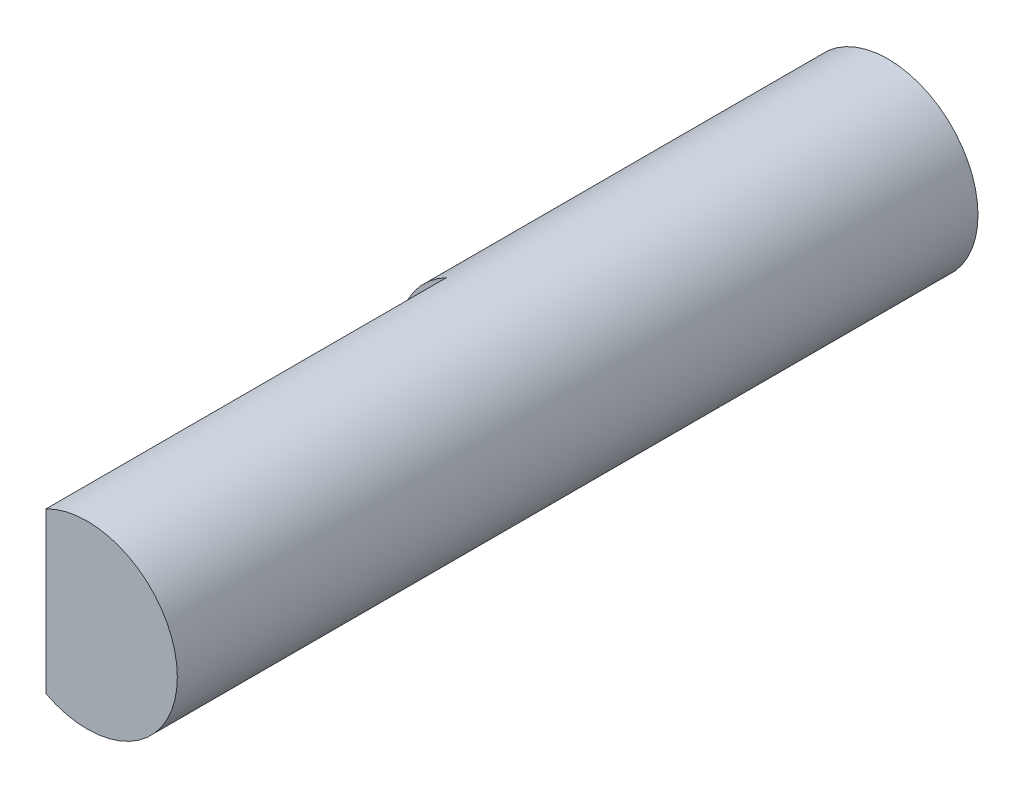
from build123d import *

# Parameters (mm, degrees)
EXTRUDE_4_DEPTH = 150
SKETCH_1_5_R    = 22.5
EXTRUDE_5_DEPTH = 100
EXTRUDE_6_DEPTH = 50
SHELL_START     = 1.5
SHELL_3_DEPTH   = 197
SHELL_3_2_DEPTH = 97


# Read off the part's stored shape, not the designer's step: 抽壳3
with BuildPart() as part:
    # 草图1 → 凸台-拉伸4 (new body)
    with BuildSketch(Plane.XY):
        with BuildLine():
            ThreePointArc((22.5, 0), (11.711646096, 19.211646096), (-10.307764064, 20))
            Line((-10.307764064, 20), (-10.307764064, -20))
            ThreePointArc((-10.307764064, -20), (11.711646096, -19.211646096), (22.5, 0))
        make_face()
    extrude(amount=EXTRUDE_4_DEPTH)

    # 草图1<5> → 凸台-拉伸5 (add)
    with BuildSketch(Plane.XY):
        with Locations(Location((0, 0, 0), (0, 0, 117.266044451))):
            Circle(SKETCH_1_5_R)
    extrude(amount=EXTRUDE_5_DEPTH)

    # 草图4 → 凸台-拉伸6 (add)
    with BuildSketch(Plane.XY.offset(150)):
        with BuildLine():
            ThreePointArc((-10.307764064, -20), (22.5, 0), (-10.307764064, 20))
            Line((-10.307764064, 20), (-10.307764064, -20))
        make_face()
    extrude(amount=EXTRUDE_6_DEPTH)

    # 抽壳3 outline → 抽壳3 (cut)
    with BuildSketch(Plane.XY.offset(SHELL_START)):
        with BuildLine():
            Line((-8.807764064, 19.063664186), (-8.807764064, -19.063664186))
            ThreePointArc((-8.807764064, -19.063664186), (21, 0), (-8.807764064, 19.063664186))
        make_face()
    extrude(amount=SHELL_3_DEPTH, mode=Mode.SUBTRACT)

    # Shell 3 2 outline → Shell 3 2 (cut)
    with BuildSketch(Plane.XY.offset(SHELL_START)):
        with BuildLine():
            ThreePointArc((-8.807764064, 19.063664186), (-21, 0), (-8.807764064, -19.063664186))
            Line((-8.807764064, -19.063664186), (-8.807764064, 19.063664186))
        make_face()
    extrude(amount=SHELL_3_2_DEPTH, mode=Mode.SUBTRACT)


solid = part.part
